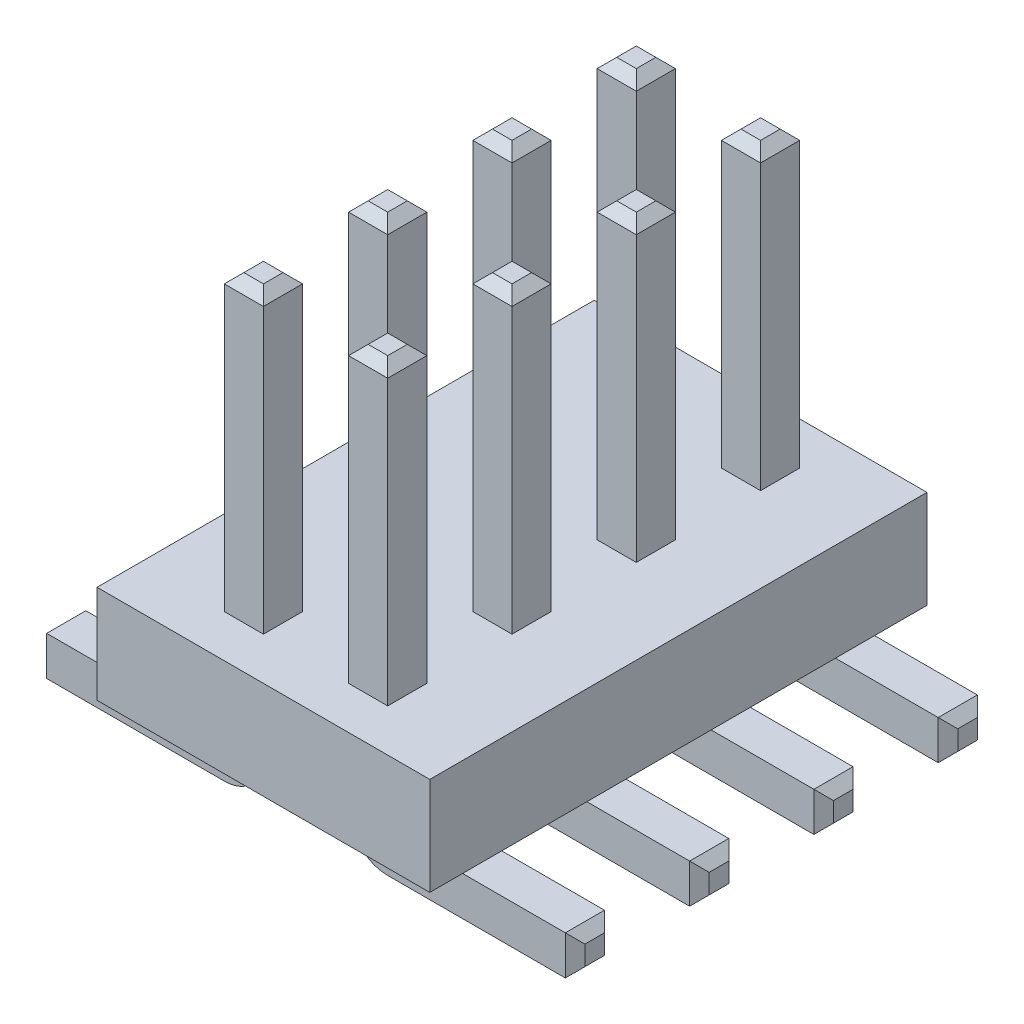
from build123d import *

# Parameters (mm, degrees)
SKIZZE1_W                         = 3.4
SKIZZE1_H                         = 1
AUFSATZ_LINEAR_AUSTRAGEN1_DEPTH   = 1.27
SKIZZE3_W                         = 0.4
SKIZZE3_H                         = 0.4
AUFSATZ_LINEAR_AUSTRAGEN3_DEPTH   = 0.5
SKIZZE4_W                         = 0.4
SKIZZE4_H                         = 0.4
AUFSATZ_LINEAR_AUSTRAGEN4_DEPTH   = 1.915
SKIZZE5_W                         = 0.4
SKIZZE5_H                         = 0.4
AUFSATZ_LINEAR_AUSTRAGEN5_DEPTH   = 1.915
SKIZZE6_W                         = 0.4
SKIZZE6_H                         = 0.4
AUFSATZ_LINEAR_AUSTRAGEN6_DEPTH   = 3
FASE2_SIZE                        = 0.1
VERRUNDUNG1_R                     = 0.1
VERRUNDUNG2_R                     = 0.4
LINEARES_MUSTER1_COUNT            = 4
LINEARES_MUSTER1_PITCH            = 1.27
FASE2_OF_LINEARES_MUSTER1_SIZE    = 0.1
VERRUNDUNG1_OF_LINEARES_MUSTER1_R = 0.1
VERRUNDUNG2_OF_LINEARES_MUSTER1_R = 0.4


with BuildPart() as part:
    # Skizze1 → Aufsatz-Linear austragen1 (new body)
    with BuildSketch(Plane.XY):
        with Locations((1.7, 0.5)):
            Rectangle(SKIZZE1_W, SKIZZE1_H)
    aufsatz_linear_austragen1 = extrude(amount=AUFSATZ_LINEAR_AUSTRAGEN1_DEPTH)

    # Skizze3 → Aufsatz-Linear austragen3 (add)
    with BuildSketch(Plane.XZ):
        with Locations((1.065, 0.635)):
            Rectangle(SKIZZE3_W, SKIZZE3_H)
        with Locations((2.335, 0.635)):
            Rectangle(SKIZZE3_W, SKIZZE3_H)
    aufsatz_linear_austragen3 = extrude(amount=AUFSATZ_LINEAR_AUSTRAGEN3_DEPTH)

    # Skizze4 → Aufsatz-Linear austragen4 (add)
    with BuildSketch(Plane(origin=(2.535, 0, 0), x_dir=(0, 0, -1), z_dir=(1, 0, 0))):
        with Locations((-0.635, -0.3)):
            Rectangle(SKIZZE4_W, SKIZZE4_H)
    aufsatz_linear_austragen4 = extrude(amount=AUFSATZ_LINEAR_AUSTRAGEN4_DEPTH)

    # Skizze5 → Aufsatz-Linear austragen5 (add)
    with BuildSketch(Plane.ZY.offset(-0.865)):
        with Locations((0.635, -0.3)):
            Rectangle(SKIZZE5_W, SKIZZE5_H)
    aufsatz_linear_austragen5 = extrude(amount=AUFSATZ_LINEAR_AUSTRAGEN5_DEPTH)

    # Skizze6 → Aufsatz-Linear austragen6 (add)
    with BuildSketch(Plane(origin=(0, 1, 0), x_dir=(1, 0, 0), z_dir=(0, 1, 0))):
        with Locations((1.065, -0.635)):
            Rectangle(SKIZZE6_W, SKIZZE6_H)
        with Locations((2.335, -0.635)):
            Rectangle(SKIZZE6_W, SKIZZE6_H)
    aufsatz_linear_austragen6 = extrude(amount=AUFSATZ_LINEAR_AUSTRAGEN6_DEPTH)

    # Fase2
    fase2_edges = [part.edges().sort_by_distance(p)[0] for p in [
        (4.45, -0.3, 0.835),
        (4.45, -0.5, 0.635),
        (4.45, -0.3, 0.435),
        (4.45, -0.1, 0.635),
        (-1.05, -0.3, 0.835),
        (-1.05, -0.1, 0.635),
        (-1.05, -0.3, 0.435),
        (-1.05, -0.5, 0.635),
        (1.265, 4, 0.635),
        (1.065, 4, 0.435),
        (0.865, 4, 0.635),
        (1.065, 4, 0.835),
        (2.535, 4, 0.635),
        (2.335, 4, 0.435),
        (2.135, 4, 0.635),
        (2.335, 4, 0.835),
    ]]
    chamfer(fase2_edges, length=FASE2_SIZE)

    # Verrundung1
    verrundung1_edges = [part.edges().sort_by_distance(p)[0] for p in [
        (0.865, -0.1, 0.635),
        (2.535, -0.1, 0.635),
    ]]
    fillet(verrundung1_edges, radius=VERRUNDUNG1_R - 0.0001)  # a hair under: the kernel refuses the full size

    # Verrundung2
    verrundung2_edges = [part.edges().sort_by_distance(p)[0] for p in [
        (1.265, -0.5, 0.635),
        (2.135, -0.5, 0.635),
    ]]
    fillet(verrundung2_edges, radius=VERRUNDUNG2_R)

    # Lineares Muster1: Aufsatz-Linear austragen1, Aufsatz-Linear austragen3, Aufsatz-Linear austragen4, Aufsatz-Linear austragen5, Aufsatz-Linear austragen6 ×4
    with Locations(*[(0, 0, i * LINEARES_MUSTER1_PITCH) for i in range(1, LINEARES_MUSTER1_COUNT)]):
        add(aufsatz_linear_austragen1)
        add(aufsatz_linear_austragen3)
        add(aufsatz_linear_austragen4)
        add(aufsatz_linear_austragen5)
        add(aufsatz_linear_austragen6)

    # Fase2 of Lineares Muster1
    fase2_of_lineares_muster1_edges = [part.edges().sort_by_distance(p)[0] for p in [
        (4.45, -0.3, 2.105),
        (4.45, -0.5, 1.905),
        (4.45, -0.3, 1.705),
        (4.45, -0.1, 1.905),
        (-1.05, -0.3, 2.105),
        (-1.05, -0.1, 1.905),
        (-1.05, -0.3, 1.705),
        (-1.05, -0.5, 1.905),
        (1.265, 4, 1.905),
        (1.065, 4, 1.705),
        (0.865, 4, 1.905),
        (1.065, 4, 2.105),
        (2.535, 4, 1.905),
        (2.335, 4, 1.705),
        (2.135, 4, 1.905),
        (2.335, 4, 2.105),
        (4.45, -0.3, 3.375),
        (4.45, -0.5, 3.175),
        (4.45, -0.3, 2.975),
        (4.45, -0.1, 3.175),
        (-1.05, -0.3, 3.375),
        (-1.05, -0.1, 3.175),
        (-1.05, -0.3, 2.975),
        (-1.05, -0.5, 3.175),
        (1.265, 4, 3.175),
        (1.065, 4, 2.975),
        (0.865, 4, 3.175),
        (1.065, 4, 3.375),
        (2.535, 4, 3.175),
        (2.335, 4, 2.975),
        (2.135, 4, 3.175),
        (2.335, 4, 3.375),
        (4.45, -0.3, 4.645),
        (4.45, -0.5, 4.445),
        (4.45, -0.3, 4.245),
        (4.45, -0.1, 4.445),
        (-1.05, -0.3, 4.645),
        (-1.05, -0.1, 4.445),
        (-1.05, -0.3, 4.245),
        (-1.05, -0.5, 4.445),
        (1.265, 4, 4.445),
        (1.065, 4, 4.245),
        (0.865, 4, 4.445),
        (1.065, 4, 4.645),
        (2.535, 4, 4.445),
        (2.335, 4, 4.245),
        (2.135, 4, 4.445),
        (2.335, 4, 4.645),
    ]]
    chamfer(fase2_of_lineares_muster1_edges, length=FASE2_OF_LINEARES_MUSTER1_SIZE)

    # Verrundung1 of Lineares Muster1
    verrundung1_of_lineares_muster1_edges = [part.edges().sort_by_distance(p)[0] for p in [
        (0.865, -0.1, 1.905),
        (2.535, -0.1, 1.905),
        (0.865, -0.1, 3.175),
        (2.535, -0.1, 3.175),
        (0.865, -0.1, 4.445),
        (2.535, -0.1, 4.445),
    ]]
    fillet(verrundung1_of_lineares_muster1_edges, radius=VERRUNDUNG1_OF_LINEARES_MUSTER1_R - 0.0001)  # a hair under: the kernel refuses the full size

    # Verrundung2 of Lineares Muster1
    verrundung2_of_lineares_muster1_edges = [part.edges().sort_by_distance(p)[0] for p in [
        (1.265, -0.5, 1.905),
        (2.135, -0.5, 1.905),
        (1.265, -0.5, 3.175),
        (2.135, -0.5, 3.175),
        (1.265, -0.5, 4.445),
        (2.135, -0.5, 4.445),
    ]]
    fillet(verrundung2_of_lineares_muster1_edges, radius=VERRUNDUNG2_OF_LINEARES_MUSTER1_R)


solid = part.part
